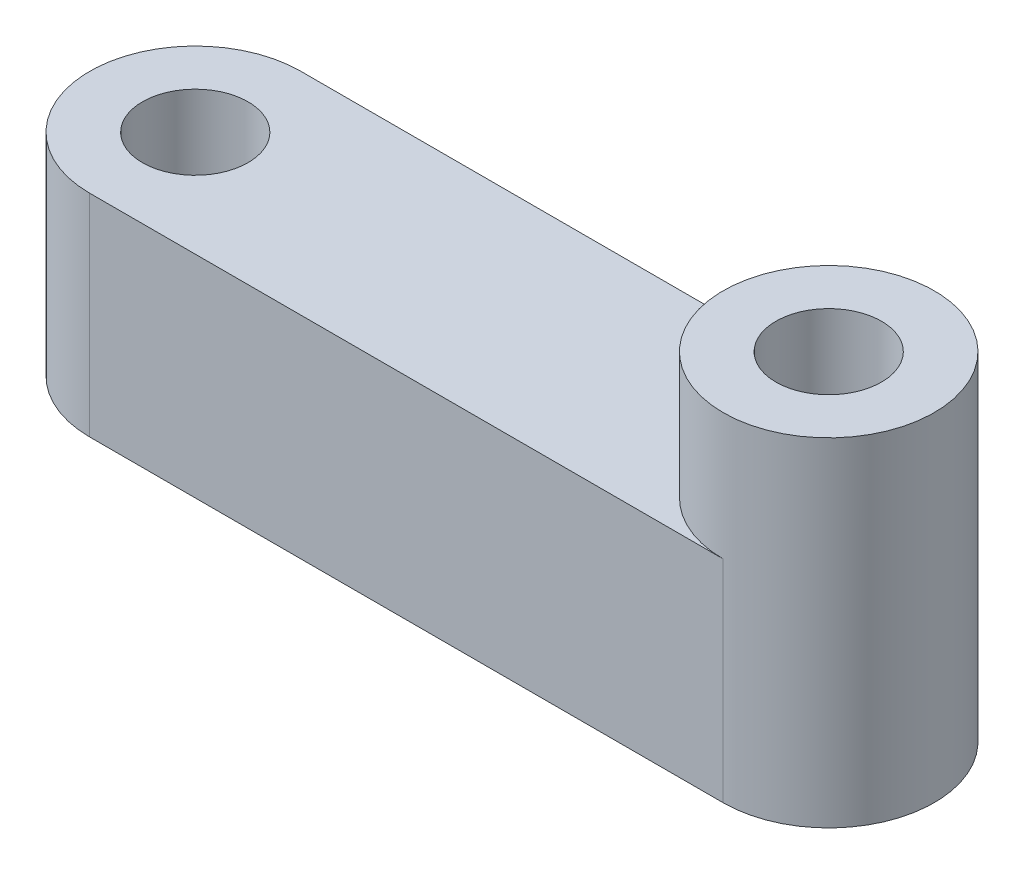
from build123d import *

# Parameters (mm, degrees)
BOSS_EXTRUDE1_DEPTH      = 4
BOSS_EXTRUDE1_DEPTH_BACK = 6
SKETCH1_R                = 2.5
BOSS_EXTRUDE3_DEPTH      = 11
BOSS_EXTRUDE3_DEPTH_BACK = 5
SKETCH3_R                = 5
SKETCH3_R_2              = 2.5


with BuildPart() as part:
    # Sketch1 → Boss-Extrude1 (new, two sides: drawn at the far end of the back side and taken through both)
    with BuildSketch(Plane(origin=(0, 0, 0), x_dir=(1, 0, 0), z_dir=(0, 1, 0)).offset(-BOSS_EXTRUDE1_DEPTH_BACK)):
        with BuildLine():
            Line((0, 5), (30, 5))
            ThreePointArc((30, 5), (35, 0), (30, -5))
            Line((30, -5), (0, -5))
            ThreePointArc((0, -5), (-5, 0), (0, 5))
        make_face()
        Circle(SKETCH1_R, mode=Mode.SUBTRACT)
        with Locations((30, 0)):
            Circle(SKETCH1_R, mode=Mode.SUBTRACT)
    extrude(amount=BOSS_EXTRUDE1_DEPTH + BOSS_EXTRUDE1_DEPTH_BACK)

    # Sketch3 → Boss-Extrude3 (add, two sides: drawn at the far end of the back side and taken through both)
    with BuildSketch(Plane(origin=(0, -1, 0), x_dir=(1, 0, 0), z_dir=(0, 1, 0)).offset(-BOSS_EXTRUDE3_DEPTH_BACK)):
        with Locations((30, 0)):
            Circle(SKETCH3_R)
        with Locations((30, 0)):
            Circle(SKETCH3_R_2, mode=Mode.SUBTRACT)
    extrude(amount=BOSS_EXTRUDE3_DEPTH + BOSS_EXTRUDE3_DEPTH_BACK)


solid = part.part
